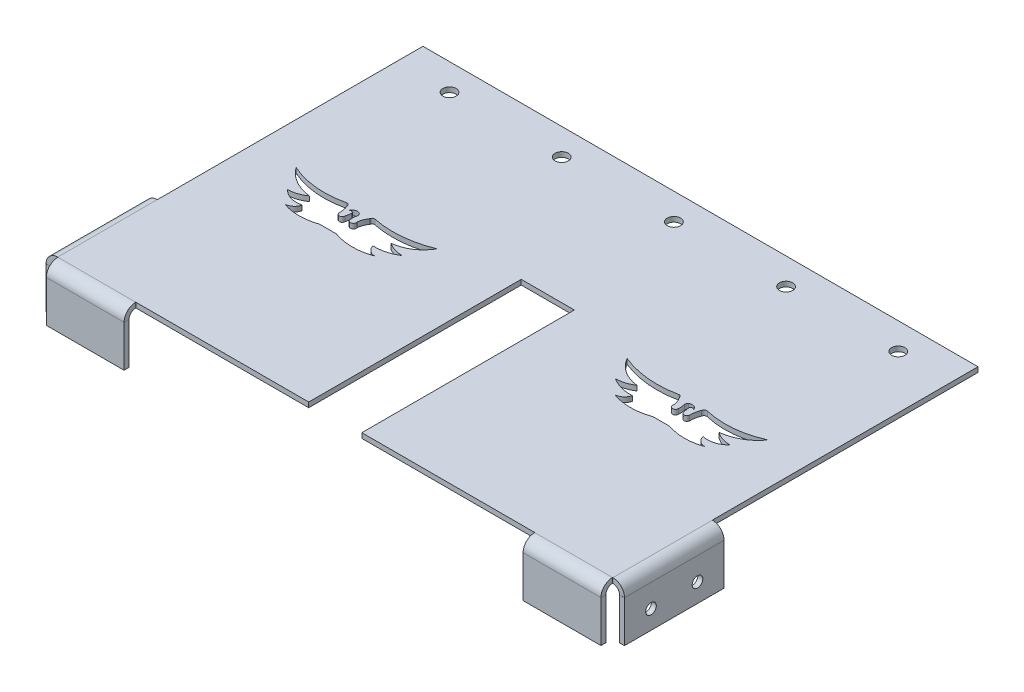
from build123d import *

# Parameters (mm, degrees)
SKETCH1_W                    = 271.78
SKETCH1_H                    = 177.8
BASE_FLANGE1_DEPTH           = 2.38125
EDGE_FLANGE1_STRIP_W         = 15.875
EDGE_FLANGE1_STRIP_H         = 2.38125
EDGE_FLANGE1_STRIP_CUT_DEPTH = 271.78
EDGE_FLANGE1_DEPTH           = 271.78
EDGE_FLANGE2_STRIP_W         = 15.875
EDGE_FLANGE2_STRIP_H         = 2.38125
EDGE_FLANGE2_STRIP_CUT_DEPTH = 174.625
EDGE_FLANGE2_DEPTH           = 174.625
SKETCH14_W                   = 127
SKETCH14_H                   = 30.097595223
CUT_EXTRUDE1_DEPTH           = 5.588
EDGE_FLANGE3_STRIP_W         = 15.875
EDGE_FLANGE3_STRIP_H         = 2.38125
EDGE_FLANGE3_STRIP_CUT_DEPTH = 174.625
EDGE_FLANGE3_DEPTH           = 174.625
SKETCH18_W                   = 127
SKETCH18_H                   = 45.504454023
CUT_EXTRUDE2_DEPTH           = 5.588
CUT_EXTRUDE3_START           = -3.302
CUT_EXTRUDE3_DEPTH           = 5.68325
CUT_EXTRUDE4_START           = -3.302
CUT_EXTRUDE4_DEPTH           = 5.68325
SKETCH24_W                   = 190.754
SKETCH24_H                   = 70.532416994
CUT_EXTRUDE5_DEPTH           = 5.588
SKETCH25_W                   = 25.4
SKETCH25_H                   = 203.2
CUT_EXTRUDE6_DEPTH           = 2.54
CUT_EXTRUDE7_DEPTH           = 168.619704027
SKETCH28_R                   = 3.175
CUT_EXTRUDE8_DEPTH           = 2.54
SKETCH29_R                   = 2.54
CUT_EXTRUDE9_DEPTH           = 330.2


# Read off the part's stored shape, not the designer's step: Cut-Extrude3, Cut-Extrude4
# Sheet-metal steps are written as plain solids
with BuildPart() as part:
    # Sketch1 → Base-Flange1 (new body)
    with BuildSketch(Plane(origin=(0, 0, 0), x_dir=(1, 0, 0), z_dir=(0, 1, 0))):
        Rectangle(SKETCH1_W, SKETCH1_H)
    extrude(amount=-BASE_FLANGE1_DEPTH)

    # Edge-Flange1 strip (across the edge) → Edge-Flange1 strip cut (cut)
    with BuildSketch(Plane(origin=(135.89, -2.38125, 88.9), x_dir=(0, 0, -1), z_dir=(-1, 0, 0))):
        with Locations((-4.7625, -1.190625)):
            Rectangle(EDGE_FLANGE1_STRIP_W, EDGE_FLANGE1_STRIP_H)
    extrude(amount=EDGE_FLANGE1_STRIP_CUT_DEPTH, mode=Mode.SUBTRACT)

    # Edge-Flange1 section (across the edge) → Edge-Flange1 (add)
    with BuildSketch(Plane(origin=(135.89, -2.38125, 88.9), x_dir=(0, 0, -1), z_dir=(-1, 0, 0))):
        with BuildLine():
            Line((-2.38125, 3.175), (-2.38125, 23.01875))
            Line((-2.38125, 23.01875), (0, 23.01875))
            Line((0, 23.01875), (0, 3.175))
            ThreePointArc((0, 3.175), (0.92993597, 0.92993597), (3.175, 0))
            Line((3.175, 0), (3.175, -2.38125))
            ThreePointArc((3.175, -2.38125), (-0.753862053, -0.753862053), (-2.38125, 3.175))
        make_face()
    extrude(amount=EDGE_FLANGE1_DEPTH)

    # Edge-Flange2 strip (across the edge) → Edge-Flange2 strip cut (cut)
    with BuildSketch(Plane(origin=(135.89, -2.38125, -88.9), x_dir=(-1, 0, 0), z_dir=(0, 0, 1))):
        with Locations((-4.7625, -1.190625)):
            Rectangle(EDGE_FLANGE2_STRIP_W, EDGE_FLANGE2_STRIP_H)
    extrude(amount=EDGE_FLANGE2_STRIP_CUT_DEPTH, mode=Mode.SUBTRACT)

    # Edge-Flange2 section (across the edge) → Edge-Flange2 (add)
    with BuildSketch(Plane(origin=(135.89, -2.38125, -88.9), x_dir=(-1, 0, 0), z_dir=(0, 0, 1))):
        with BuildLine():
            Line((-2.38125, 3.175), (-2.38125, 23.01875))
            Line((-2.38125, 23.01875), (0, 23.01875))
            Line((0, 23.01875), (0, 3.175))
            ThreePointArc((0, 3.175), (0.92993597, 0.92993597), (3.175, 0))
            Line((3.175, 0), (3.175, -2.38125))
            ThreePointArc((3.175, -2.38125), (-0.753862053, -0.753862053), (-2.38125, 3.175))
        make_face()
    extrude(amount=EDGE_FLANGE2_DEPTH)

    # Sketch14 → Cut-Extrude1 (cut)
    with BuildSketch(Plane(origin=(138.27125, 0, 0), x_dir=(0, 0, -1), z_dir=(1, 0, 0))):
        with Locations((25.4, -10.351202389)):
            Rectangle(SKETCH14_W, SKETCH14_H)
    extrude(amount=-CUT_EXTRUDE1_DEPTH, mode=Mode.SUBTRACT)

    # Edge-Flange3 strip (across the edge) → Edge-Flange3 strip cut (cut)
    with BuildSketch(Plane(origin=(-135.89, -2.38125, 85.725), x_dir=(1, 0, 0), z_dir=(0, 0, -1))):
        with Locations((-4.7625, -1.190625)):
            Rectangle(EDGE_FLANGE3_STRIP_W, EDGE_FLANGE3_STRIP_H)
    extrude(amount=EDGE_FLANGE3_STRIP_CUT_DEPTH, mode=Mode.SUBTRACT)

    # Edge-Flange3 section (across the edge) → Edge-Flange3 (add)
    with BuildSketch(Plane(origin=(-135.89, -2.38125, 85.725), x_dir=(1, 0, 0), z_dir=(0, 0, -1))):
        with BuildLine():
            Line((-2.38125, 3.175), (-2.38125, 23.01875))
            Line((-2.38125, 23.01875), (0, 23.01875))
            Line((0, 23.01875), (0, 3.175))
            ThreePointArc((0, 3.175), (0.92993597, 0.92993597), (3.175, 0))
            Line((3.175, 0), (3.175, -2.38125))
            ThreePointArc((3.175, -2.38125), (-0.753862053, -0.753862053), (-2.38125, 3.175))
        make_face()
    extrude(amount=EDGE_FLANGE3_DEPTH)

    # Sketch18 → Cut-Extrude2 (cut)
    with BuildSketch(Plane.ZY.offset(138.27125)):
        with Locations((-25.4, -2.647772988)):
            Rectangle(SKETCH18_W, SKETCH18_H)
    extrude(amount=-CUT_EXTRUDE2_DEPTH, mode=Mode.SUBTRACT)

    # Cut-Extrude3 outline → Cut-Extrude3 (cut)
    with BuildSketch(Plane.ZY.offset(135.89).offset(CUT_EXTRUDE3_START)):
        with BuildLine():
            Line((85.725, 0), (85.69325, 0))
            Line((85.69325, 0), (85.69325, -5.55625))
            Line((85.69325, -5.55625), (85.725, -5.55625))
            Line((85.725, -5.55625), (85.725, -2.38125))
            ThreePointArc((85.725, -2.38125), (87.97006403, -3.31118597), (88.9, -5.55625))
            Line((88.9, -5.55625), (88.9, -25.4))
            Line((88.9, -25.4), (91.28125, -25.4))
            Line((91.28125, -25.4), (91.28125, -5.55625))
            ThreePointArc((91.28125, -5.55625), (89.653862053, -1.627387947), (85.725, 0))
        make_face()
    extrude(amount=CUT_EXTRUDE3_DEPTH, mode=Mode.SUBTRACT)

    # Cut-Extrude4 outline → Cut-Extrude4 (cut)
    with BuildSketch(Plane(origin=(135.89, 0, 0), x_dir=(0, 0, -1), z_dir=(1, 0, 0)).offset(CUT_EXTRUDE4_START)):
        with BuildLine():
            Line((-85.69325, 0), (-85.725, 0))
            ThreePointArc((-85.725, 0), (-89.653862053, -1.627387947), (-91.28125, -5.55625))
            Line((-91.28125, -5.55625), (-91.28125, -25.4))
            Line((-91.28125, -25.4), (-88.9, -25.4))
            Line((-88.9, -25.4), (-88.9, -5.55625))
            ThreePointArc((-88.9, -5.55625), (-87.97006403, -3.31118597), (-85.725, -2.38125))
            Line((-85.725, -2.38125), (-85.725, -5.55625))
            Line((-85.725, -5.55625), (-85.69325, -5.55625))
            Line((-85.69325, -5.55625), (-85.69325, 0))
        make_face()
    extrude(amount=CUT_EXTRUDE4_DEPTH, mode=Mode.SUBTRACT)

    # Sketch24 → Cut-Extrude5 (cut)
    with BuildSketch(Plane.XY.offset(91.28125)):
        Rectangle(SKETCH24_W, SKETCH24_H)
    extrude(amount=-CUT_EXTRUDE5_DEPTH, mode=Mode.SUBTRACT)

    # Sketch25 → Cut-Extrude6 (cut)
    with BuildSketch(Plane(origin=(0, 0, 0), x_dir=(1, 0, 0), z_dir=(0, 1, 0))):
        with Locations((0, -85.69325)):
            Rectangle(SKETCH25_W, SKETCH25_H)
    extrude(amount=-CUT_EXTRUDE6_DEPTH, mode=Mode.SUBTRACT)

    # Sketch27 → Cut-Extrude7 (cut, through all)
    with BuildSketch(Plane(origin=(0, 0, 0), x_dir=(1, 0, 0), z_dir=(0, 1, 0))):
        with BuildLine():
            Line((-83.758838792, -9.45585461), (-75.67290259, -9.45585461))
            ThreePointArc((-75.67290259, -9.45585461), (-66.490988533, -11.087337706), (-57.309074476, -9.45585461))
            ThreePointArc((-57.309074476, -9.45585461), (-60.311983549, -8.390373583), (-61.996874262, -5.685959414))
            ThreePointArc((-61.996874262, -5.685959414), (-56.305231118, -5.091134548), (-51.075646545, -2.767330875))
            ThreePointArc((-51.075646545, -2.767330875), (-55.130053613, -2.067384812), (-58.848260419, -0.305828877))
            ThreePointArc((-58.848260419, -0.305828877), (-51.075646545, 2.428004784), (-45.41334394, 8.413462337))
            ThreePointArc((-45.41334394, 8.413462337), (-58.848260419, 5.108292363), (-72.661500429, 5.892849412))
            ThreePointArc((-72.661500429, 5.892849412), (-73.515570568, 5.659234682), (-73.954298796, 4.890125335))
            ThreePointArc((-73.954298796, 4.890125335), (-75.13069526, 2.764954432), (-75.67290259, 0.397197853))
            ThreePointArc((-75.67290259, 0.397197853), (-76.825891015, -1.427766493), (-78.414472909, 0.033836989))
            ThreePointArc((-78.414472909, 0.033836989), (-78.361782981, 1.568210714), (-78.121423666, 3.084557099))
            ThreePointArc((-78.121423666, 3.084557099), (-78.226332012, 3.859871666), (-78.703089746, 4.480210688))
            ThreePointArc((-78.703089746, 4.480210688), (-80.87974367, 4.787634603), (-82.4208484, 3.22004793))
            ThreePointArc((-82.4208484, 3.22004793), (-81.410815763, 3.612426431), (-80.592319592, 2.902362466))
            ThreePointArc((-80.592319592, 2.902362466), (-80.7316121, 1.449976952), (-81.082858007, 0.033836989))
            ThreePointArc((-81.082858007, 0.033836989), (-82.403929905, -1.321071898), (-83.758838792, 0))
            ThreePointArc((-83.758838792, 0), (-83.995302952, 2.406365651), (-84.636907307, 4.737643154))
            ThreePointArc((-84.636907307, 4.737643154), (-85.225763559, 5.644402971), (-86.283323823, 5.869194738))
            ThreePointArc((-86.283323823, 5.869194738), (-99.782272929, 4.924826167), (-112.856785411, 8.413462337))
            ThreePointArc((-112.856785411, 8.413462337), (-106.309643061, 2.541856444), (-97.946894022, -0.179403782))
            ThreePointArc((-97.946894022, -0.179403782), (-101.622165605, -2.103854793), (-105.71739849, -2.767330875))
            ThreePointArc((-105.71739849, -2.767330875), (-101.192410266, -5.584137657), (-95.863287335, -5.685959414))
            ThreePointArc((-95.863287335, -5.685959414), (-97.475971718, -8.374084711), (-100.418171986, -9.45585461))
            ThreePointArc((-100.418171986, -9.45585461), (-92.088505389, -10.899131081), (-83.758838792, -9.45585461))
        make_face()
        with BuildLine():
            Line((83.758838792, -9.45585461), (75.67290259, -9.45585461))
            ThreePointArc((75.67290259, -9.45585461), (66.490988533, -11.087337706), (57.309074476, -9.45585461))
            ThreePointArc((57.309074476, -9.45585461), (60.311983549, -8.390373583), (61.996874262, -5.685959414))
            ThreePointArc((61.996874262, -5.685959414), (56.305231118, -5.091134548), (51.075646545, -2.767330875))
            ThreePointArc((51.075646545, -2.767330875), (55.130053613, -2.067384812), (58.848260419, -0.305828877))
            ThreePointArc((58.848260419, -0.305828877), (51.075646545, 2.428004784), (45.41334394, 8.413462337))
            ThreePointArc((45.41334394, 8.413462337), (58.848260419, 5.108292363), (72.661500429, 5.892849412))
            ThreePointArc((72.661500429, 5.892849412), (73.515570568, 5.659234682), (73.954298796, 4.890125335))
            ThreePointArc((73.954298796, 4.890125335), (75.13069526, 2.764954432), (75.67290259, 0.397197853))
            ThreePointArc((75.67290259, 0.397197853), (76.825891015, -1.427766493), (78.414472909, 0.033836989))
            ThreePointArc((78.414472909, 0.033836989), (78.361782981, 1.568210714), (78.121423666, 3.084557099))
            ThreePointArc((78.121423666, 3.084557099), (78.226332012, 3.859871666), (78.703089746, 4.480210688))
            ThreePointArc((78.703089746, 4.480210688), (80.87974367, 4.787634603), (82.4208484, 3.22004793))
            ThreePointArc((82.4208484, 3.22004793), (81.410815763, 3.612426431), (80.592319592, 2.902362466))
            ThreePointArc((80.592319592, 2.902362466), (80.7316121, 1.449976952), (81.082858007, 0.033836989))
            ThreePointArc((81.082858007, 0.033836989), (82.403929905, -1.321071898), (83.758838792, 0))
            ThreePointArc((83.758838792, 0), (83.995302952, 2.406365651), (84.636907307, 4.737643154))
            ThreePointArc((84.636907307, 4.737643154), (85.225763559, 5.644402971), (86.283323823, 5.869194738))
            ThreePointArc((86.283323823, 5.869194738), (99.782272929, 4.924826167), (112.856785411, 8.413462337))
            ThreePointArc((112.856785411, 8.413462337), (106.309643061, 2.541856444), (97.946894022, -0.179403782))
            ThreePointArc((97.946894022, -0.179403782), (101.622165605, -2.103854793), (105.71739849, -2.767330875))
            ThreePointArc((105.71739849, -2.767330875), (101.192410266, -5.584137657), (95.863287335, -5.685959414))
            ThreePointArc((95.863287335, -5.685959414), (97.475971718, -8.374084711), (100.418171986, -9.45585461))
            ThreePointArc((100.418171986, -9.45585461), (92.088505389, -10.899131081), (83.758838792, -9.45585461))
        make_face()
    extrude(amount=-CUT_EXTRUDE7_DEPTH, mode=Mode.SUBTRACT)

    # Sketch28 → Cut-Extrude8 (cut)
    with BuildSketch(Plane(origin=(0, 0, 0), x_dir=(1, 0, 0), z_dir=(0, 1, 0))):
        with Locations(Location((-107.28325, 76.2, 0), (0, 0, 270))):
            Circle(SKETCH28_R)
        with Locations(Location((-53.641625, 76.2, 0), (0, 0, 270))):
            Circle(SKETCH28_R)
        with Locations(Location((0, 76.2, 0), (0, 0, 270))):
            Circle(SKETCH28_R)
        with Locations(Location((53.641625, 76.2, 0), (0, 0, 270))):
            Circle(SKETCH28_R)
        with Locations(Location((107.28325, 76.2, 0), (0, 0, 270))):
            Circle(SKETCH28_R)
    extrude(amount=-CUT_EXTRUDE8_DEPTH, mode=Mode.SUBTRACT)

    # Sketch29 → Cut-Extrude9 (cut)
    with BuildSketch(Plane(origin=(138.27125, 0, 0), x_dir=(0, 0, -1), z_dir=(1, 0, 0))):
        with Locations(Location((-50.8, -16.438000035, 0), (0, 0, 90))):
            Circle(SKETCH29_R)
        with Locations(Location((-73.025, -16.438000035, 0), (0, 0, 90))):
            Circle(SKETCH29_R)
    extrude(amount=-CUT_EXTRUDE9_DEPTH, mode=Mode.SUBTRACT)


solid = part.part
